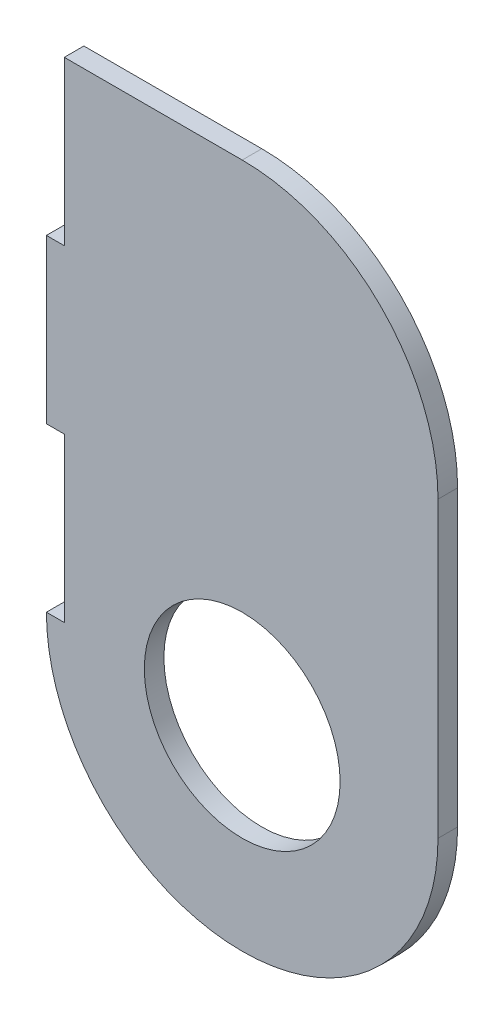
from build123d import *

# Parameters (mm, degrees)
ESQUISSE1_W             = 60
ESQUISSE1_H             = 105
BOSS_EXTRU_1_DEPTH      = 3
CONG_1_R                = 30
ESQUISSE2_R             = 15
ENL_V_MAT_EXTRU_1_DEPTH = 3
ESQUISSE3_W             = 2.740256741
ESQUISSE3_H             = 25
ENL_V_MAT_EXTRU_2_DEPTH = 3
CONG_2_R                = 30


with BuildPart() as part:
    # Esquisse1 → Boss.-Extru.1 (new body)
    with BuildSketch(Plane.XY):
        with Locations((30, 52.5)):
            Rectangle(ESQUISSE1_W, ESQUISSE1_H)
    extrude(amount=BOSS_EXTRU_1_DEPTH)

    # Congé1
    cong_1_edges = [part.edges().sort_by_distance(p)[0] for p in [
        (60, 0, 1.5),
        (0, 0, 1.5),
    ]]
    fillet(cong_1_edges, radius=CONG_1_R - 0.0001)  # a hair under: the kernel refuses the full size

    # Esquisse2 → Enlèv. mat.-Extru.1 (cut)
    with BuildSketch(Plane.XY.offset(3)):
        with Locations((30, 30)):
            Circle(ESQUISSE2_R)
    extrude(amount=-ENL_V_MAT_EXTRU_1_DEPTH, mode=Mode.SUBTRACT)

    # Esquisse3 → Enlèv. mat.-Extru.2 (cut)
    with BuildSketch(Plane.XY.offset(3)):
        with Locations((1.370128371, 42.5)):
            Rectangle(ESQUISSE3_W, ESQUISSE3_H)
        with Locations((1.370128371, 92.5)):
            Rectangle(ESQUISSE3_W, ESQUISSE3_H)
    extrude(amount=-ENL_V_MAT_EXTRU_2_DEPTH, mode=Mode.SUBTRACT)

    # Congé2
    cong_2_edges = [part.edges().sort_by_distance(p)[0] for p in [
        (60, 105, 1.5),
    ]]
    fillet(cong_2_edges, radius=CONG_2_R)


solid = part.part
